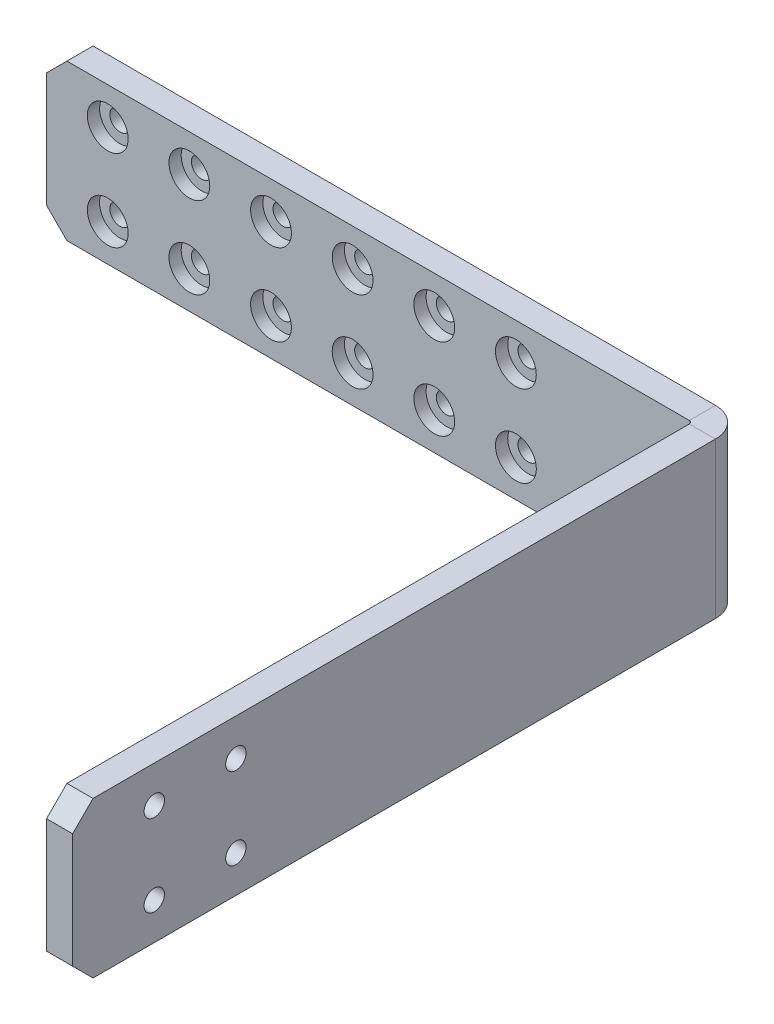
from build123d import *

# Parameters (mm, degrees)
SKETCH1_W                  = 320
SKETCH1_H                  = 38.1
SKETCH1_R                  = 2.5
BASE_FLANGE1_DEPTH         = 6.4
CHAMFER2_SIZE              = 5
SKETCH32_R                 = 5
CUT_EXTRUDE2_DEPTH         = 3
SKETCHED_START             = 4.650863044
SKETCHED_BEND1_OUTLINE_W   = 38.1
SKETCHED_BEND1_OUTLINE_H   = 6.4
SKETCHED_BEND1_DEPTH       = 155.349136956
SKETCHED_START_2           = -2.499136956
SKETCHED_BEND1_2_OUTLINE_R = 2.5
SKETCHED_BEND1_2_DEPTH     = 7.15
SKETCHED_START_3           = -20
SKETCHED_BEND1_3_DEPTH     = 40


with BuildPart() as part:
    # Base-Flange1: sheet metal written as solids
    # Sketch1 → Base-Flange1 (new body)
    with BuildSketch(Plane.XY):
        Rectangle(SKETCH1_W, SKETCH1_H)
        with Locations((-145, 10)):
            Circle(SKETCH1_R, mode=Mode.SUBTRACT)
        with Locations((-125, 10)):
            Circle(SKETCH1_R, mode=Mode.SUBTRACT)
        with Locations((-105, 10)):
            Circle(SKETCH1_R, mode=Mode.SUBTRACT)
        with Locations((-85, 10)):
            Circle(SKETCH1_R, mode=Mode.SUBTRACT)
        with Locations((-65, 10)):
            Circle(SKETCH1_R, mode=Mode.SUBTRACT)
        with Locations((-45, 10)):
            Circle(SKETCH1_R, mode=Mode.SUBTRACT)
        with Locations(Location((-145, -10, 0), (0, 0, 180))):
            Circle(SKETCH1_R, mode=Mode.SUBTRACT)
        with Locations(Location((-125, -10, 0), (0, 0, 180))):
            Circle(SKETCH1_R, mode=Mode.SUBTRACT)
        with Locations(Location((-105, -10, 0), (0, 0, 180))):
            Circle(SKETCH1_R, mode=Mode.SUBTRACT)
        with Locations(Location((-85, -10, 0), (0, 0, 180))):
            Circle(SKETCH1_R, mode=Mode.SUBTRACT)
        with Locations(Location((-65, -10, 0), (0, 0, 180))):
            Circle(SKETCH1_R, mode=Mode.SUBTRACT)
        with Locations(Location((-45, -10, 0), (0, 0, 180))):
            Circle(SKETCH1_R, mode=Mode.SUBTRACT)
        with Locations((140, 10)):
            Circle(SKETCH1_R, mode=Mode.SUBTRACT)
        with Locations((120, 10)):
            Circle(SKETCH1_R, mode=Mode.SUBTRACT)
        with Locations((120, -10)):
            Circle(SKETCH1_R, mode=Mode.SUBTRACT)
        with Locations((140, -10)):
            Circle(SKETCH1_R, mode=Mode.SUBTRACT)
    extrude(amount=-BASE_FLANGE1_DEPTH)

    # Chamfer2
    chamfer2_edges = [part.edges().sort_by_distance(p)[0] for p in [
        (-160, 19.05, -3.2),
        (160, 19.05, -3.2),
        (160, -19.05, -3.2),
        (-160, -19.05, -3.2),
    ]]
    chamfer(chamfer2_edges, length=CHAMFER2_SIZE)

    # Sketch32 → Cut-Extrude2 (cut)
    with BuildSketch(Plane.XY):
        with Locations((-145, 10)):
            Circle(SKETCH32_R)
        with Locations((-125, 10)):
            Circle(SKETCH32_R)
        with Locations((-105, 10)):
            Circle(SKETCH32_R)
        with Locations((-85, 10)):
            Circle(SKETCH32_R)
        with Locations((-65, 10)):
            Circle(SKETCH32_R)
        with Locations((-45, 10)):
            Circle(SKETCH32_R)
        with Locations(Location((-45, -10, 0), (0, 0, 180))):
            Circle(SKETCH32_R)
        with Locations(Location((-65, -10, 0), (0, 0, 180))):
            Circle(SKETCH32_R)
        with Locations(Location((-85, -10, 0), (0, 0, 180))):
            Circle(SKETCH32_R)
        with Locations(Location((-105, -10, 0), (0, 0, 180))):
            Circle(SKETCH32_R)
        with Locations(Location((-125, -10, 0), (0, 0, 180))):
            Circle(SKETCH32_R)
        with Locations(Location((-145, -10, 0), (0, 0, 180))):
            Circle(SKETCH32_R)
    extrude(amount=-CUT_EXTRUDE2_DEPTH, mode=Mode.SUBTRACT)

    # Sketched Bend1: read off the stored shape, not the designer's step
    # Sketched Bend1 outline → Sketched Bend1 (cut)
    with BuildSketch(Plane.YZ.offset(SKETCHED_START)):
        with Locations((0, -3.2)):
            Rectangle(SKETCHED_BEND1_OUTLINE_W, SKETCHED_BEND1_OUTLINE_H)
    extrude(amount=SKETCHED_BEND1_DEPTH, mode=Mode.SUBTRACT)

    # Sketched Bend1 2 outline → Sketched Bend1 2 (add)
    with BuildSketch(Plane.YZ.offset(SKETCHED_START_2)):
        Polygon((-19.05, 0), (19.05, 0), (19.05, 153.250863044), (14.05, 158.250863044), (-14.05, 158.250863044), (-19.05, 153.250863044), align=None)
        with Locations((-10, 118.250863044)):
            Circle(SKETCHED_BEND1_2_OUTLINE_R, mode=Mode.SUBTRACT)
        with Locations((-10, 138.250863044)):
            Circle(SKETCHED_BEND1_2_OUTLINE_R, mode=Mode.SUBTRACT)
        with Locations((10, 118.250863044)):
            Circle(SKETCHED_BEND1_2_OUTLINE_R, mode=Mode.SUBTRACT)
        with Locations((10, 138.250863044)):
            Circle(SKETCHED_BEND1_2_OUTLINE_R, mode=Mode.SUBTRACT)
    extrude(amount=SKETCHED_BEND1_2_DEPTH)

    # Sketched Bend1 3 outline → Sketched Bend1 3 (cut)
    with BuildSketch(Plane(origin=(0, 0, 0), x_dir=(1, 0, 0), z_dir=(0, 1, 0)).offset(SKETCHED_START_3)):
        with BuildLine():
            Line((4.650863044, 6.4), (-2.499136956, 6.4))
            ThreePointArc((-2.499136956, 6.4), (2.55667653, 4.305813485), (4.650863044, -0.75))
            Line((4.650863044, -0.75), (4.650863044, 6.4))
        make_face()
        with BuildLine():
            Line((-2.499136956, -158.250863044), (-1.749136956, -158.250863044))
            Line((-1.749136956, -158.250863044), (-1.749136956, -0.75))
            ThreePointArc((-1.749136956, -0.75), (-1.96880687, -0.219669914), (-2.499136956, 0))
            Line((-2.499136956, 0), (-2.499136956, -158.250863044))
        make_face()
    extrude(amount=SKETCHED_BEND1_3_DEPTH, mode=Mode.SUBTRACT)


solid = part.part
